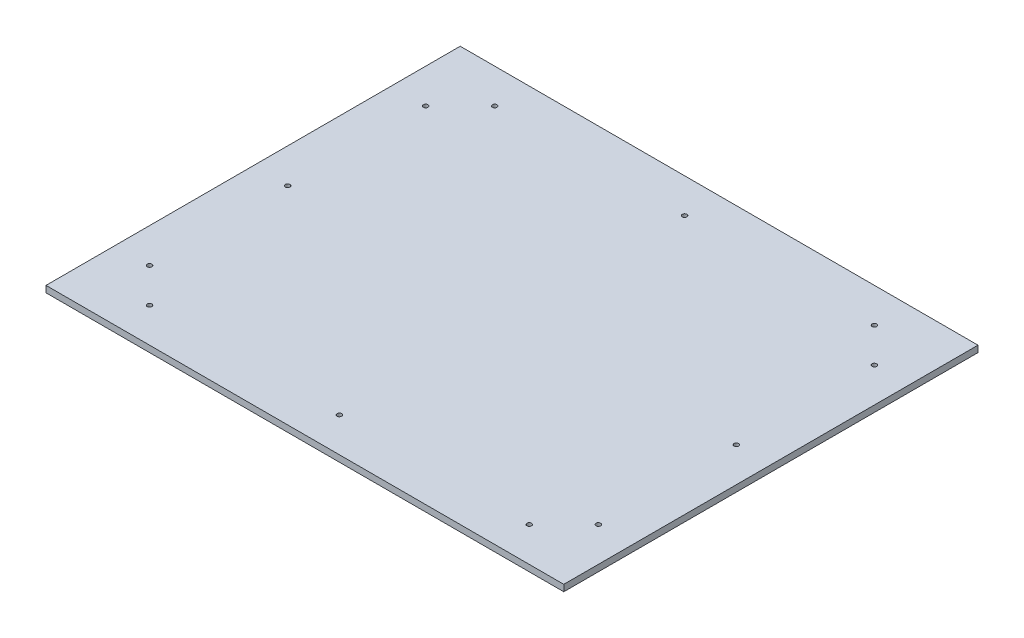
from build123d import *

# Parameters (mm, degrees)
SKETCH1_W            = 381
SKETCH1_H            = 304.8
BOSS_EXTRUDE1_DEPTH  = 4.7625
M3_CLEARANCE_HOLE1_D = 3.4


with BuildPart() as part:
    # Sketch1 → Boss-Extrude1 (new body)
    with BuildSketch(Plane(origin=(0, 0, 0), x_dir=(1, 0, 0), z_dir=(0, 1, 0))):
        Rectangle(SKETCH1_W, SKETCH1_H)
    extrude(amount=BOSS_EXTRUDE1_DEPTH)

    # M3 Clearance Hole1 (through all)
    with Locations(Plane(origin=(-165.1, 4.7625, 101.6), x_dir=(0, 0, 1), z_dir=(0, 1, 0))):
        with Locations((0, 0), (-101.6, 0), (-203.2, 0), (-228.6, 25.4), (-228.6, 165.1), (-228.6, 304.8), (-203.2, 330.2), (-101.6, 330.2), (0, 330.2), (25.4, 304.8), (25.4, 165.1), (25.4, 25.4)):
            Hole(M3_CLEARANCE_HOLE1_D / 2)


solid = part.part
